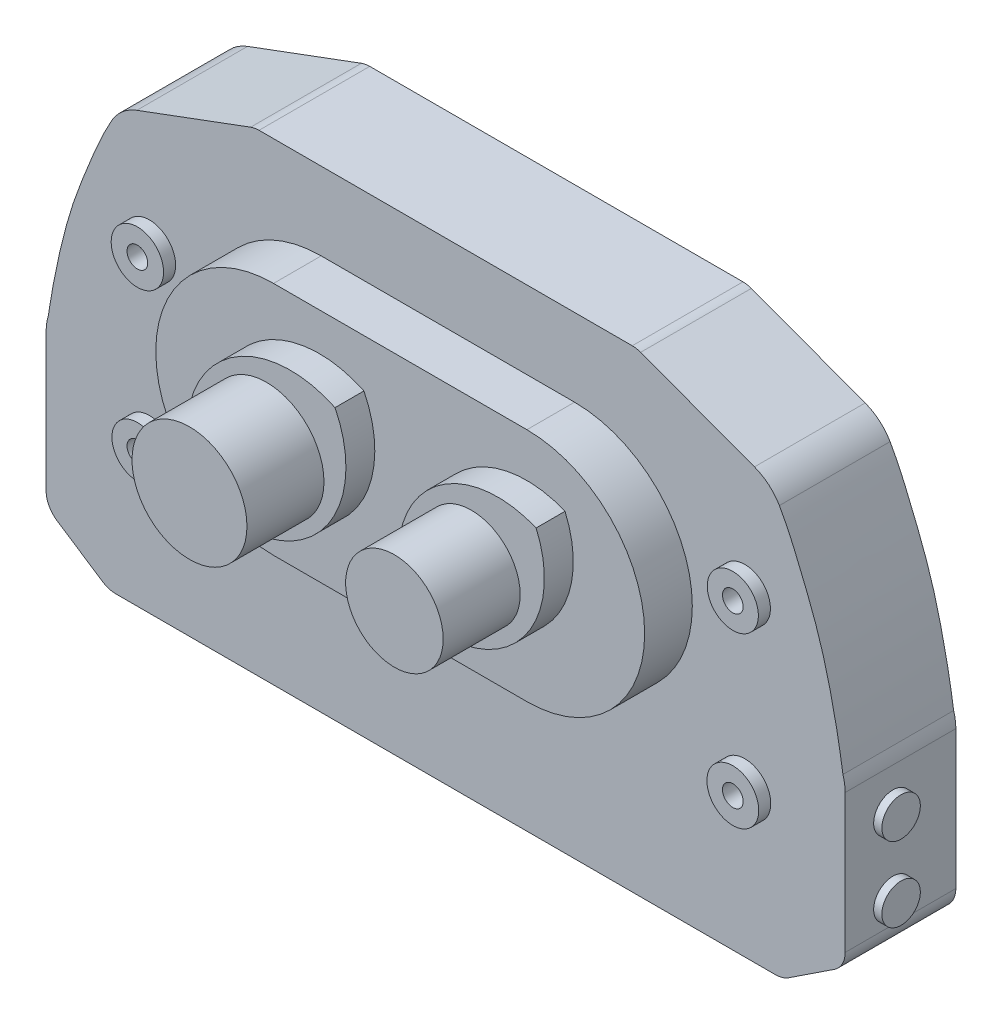
from build123d import *

# Parameters (mm, degrees)
BOSS_EXTRUDE1_DEPTH = 23
SKETCH5_R           = 4
BOSS_EXTRUDE3_DEPTH = 1.7
SKETCH8_R           = 4
BOSS_EXTRUDE4_DEPTH = 1.7
SKETCH12_R          = 5.309585237
SKETCH12_R_2        = 5.383577716
SKETCH12_R_3        = 5.290961271
SKETCH12_R_4        = 5.444301549
BOSS_EXTRUDE5_DEPTH = 9.9
BOSS_EXTRUDE6_DEPTH = 22
CUT_EXTRUDE1_START  = -16
SKETCH16_R          = 11.94
CUT_EXTRUDE1_DEPTH  = 16
CUT_EXTRUDE2_START  = -16
SKETCH17_R          = 10.13
CUT_EXTRUDE2_DEPTH  = 16
CUT_EXTRUDE3_START  = -7.4
SKETCH18_R          = 5.309585237
CUT_EXTRUDE3_DEPTH  = 7.4
CUT_EXTRUDE4_START  = -7.4
SKETCH19_R          = 5.383577716
CUT_EXTRUDE4_DEPTH  = 7.4
CUT_EXTRUDE5_START  = -7.4
SKETCH20_R          = 5.444301549
CUT_EXTRUDE5_DEPTH  = 7.4
CUT_EXTRUDE6_START  = -7.4
SKETCH21_R          = 5.290961271
CUT_EXTRUDE6_DEPTH  = 7.4
SKETCH22_R          = 2.15
CUT_EXTRUDE7_DEPTH  = 10


with BuildPart() as part:
    # Sketch2 → Boss-Extrude1 (new body)
    with BuildSketch(Plane.XY):
        with BuildLine():
            Line((70.523413182, -121.258597495), (80.001788964, -115.008475165))
            ThreePointArc((80.001788964, -115.008475165), (81.651709385, -113.204688447), (82.249297777, -110.834293536))
            Line((82.249297777, -110.834293536), (82.249297777, -82.060728072))
            ThreePointArc((82.249297777, -82.060728072), (82.132627635, -80.537642087), (81.785339594, -79.050095835))
            add(Edge.make_bspline(
                [(81.785339594, -79.050095835), (81.779550585, -79.03175941), (79.763594577, -64.21980724), (72.310783114, -44.632084365), (70.089271073, -39.87053002), (68.584818962, -37.26596578)],
                knots=[0.01010668, 0.01010668, 0.01010668, 0.01010668, 0.430228508, 0.512694162, 0.834763224, 0.834763224, 0.834763224, 0.834763224], degree=3))
            ThreePointArc((68.584818962, -37.26596578), (66.377835563, -34.627803803), (63.407507036, -32.893496223))
            Line((63.407507036, -32.893496223), (39.759590264, -24.109812278))
            ThreePointArc((39.759590264, -24.109812278), (38.90305511, -23.875770322), (38.018627658, -23.796927511))
            Line((38.018627658, -23.796927511), (-39.520032104, -23.796927511))
            ThreePointArc((-39.520032104, -23.796927511), (-40.404459556, -23.875770322), (-41.26099471, -24.109812278))
            Line((-41.26099471, -24.109812278), (-64.908911482, -32.893496223))
            ThreePointArc((-64.908911482, -32.893496223), (-67.879240009, -34.627803803), (-70.086223408, -37.26596578))
            add(Edge.make_bspline(
                [(-83.28674404, -79.050095835), (-83.280955031, -79.03175941), (-81.264999023, -64.21980724), (-73.81218756, -44.632084365), (-71.590675519, -39.87053002), (-70.086223408, -37.26596578)],
                knots=[0.01010668, 0.01010668, 0.01010668, 0.01010668, 0.430228508, 0.512694162, 0.834763224, 0.834763224, 0.834763224, 0.834763224], degree=3))
            ThreePointArc((-83.28674404, -79.050095835), (-83.634032081, -80.537642087), (-83.750702223, -82.060728072))
            Line((-83.750702223, -82.060728072), (-83.750702223, -110.834293536))
            ThreePointArc((-83.750702223, -110.834293536), (-83.153113831, -113.204688447), (-81.50319341, -115.008475165))
            Line((-81.50319341, -115.008475165), (-72.024817629, -121.258597495))
            ThreePointArc((-72.024817629, -121.258597495), (-70.709179228, -121.873513284), (-69.272326442, -122.084415867))
            Line((-69.272326442, -122.084415867), (67.770921996, -122.084415867))
            ThreePointArc((67.770921996, -122.084415867), (69.207774782, -121.873513284), (70.523413182, -121.258597495))
        make_face()
    extrude(amount=BOSS_EXTRUDE1_DEPTH)

    # Sketch5 → Boss-Extrude3 (add)
    with BuildSketch(Plane.ZY.offset(83.750702223)):
        with Locations((13.083649818, -90.551709518)):
            Circle(SKETCH5_R)
        with Locations((13.083649818, -106.069633318)):
            Circle(SKETCH5_R)
    extrude(amount=BOSS_EXTRUDE3_DEPTH)

    # Sketch8 → Boss-Extrude4 (add)
    with BuildSketch(Plane(origin=(82.249297777, 0, 0), x_dir=(0, 0, -1), z_dir=(1, 0, 0))):
        with Locations((-13.08, -90.550728072)):
            Circle(SKETCH8_R)
        with Locations((-13.08, -106.070728072)):
            Circle(SKETCH8_R)
    extrude(amount=BOSS_EXTRUDE4_DEPTH)

    # Sketch12 → Boss-Extrude5 (add)
    with BuildSketch(Plane.XY.offset(23)):
        with Locations((61.412858859, -56.74856372)):
            Circle(SKETCH12_R)
        with Locations((61.412858859, -91.784557501)):
            Circle(SKETCH12_R_2)
        with Locations((-62.293922582, -91.784557501)):
            Circle(SKETCH12_R_3)
        with Locations((-62.293922582, -56.74856372)):
            Circle(SKETCH12_R_4)
        with BuildLine():
            Line((26.03317791, -39.941081705), (-26.605656617, -39.941081705))
            ThreePointArc((-26.605656617, -39.941081705), (-51.069934746, -64.405359834), (-26.605656617, -88.869637962))
            Line((-26.605656617, -88.869637962), (26.03317791, -88.869637962))
            ThreePointArc((26.03317791, -88.869637962), (50.497456038, -64.405359834), (26.03317791, -39.941081705))
        make_face()
    extrude(amount=BOSS_EXTRUDE5_DEPTH)

    # Sketch15 → Boss-Extrude6 (add)
    with BuildSketch(Plane.XY.offset(32.9)):
        with BuildLine():
            ThreePointArc((-36.30694092, -78.897586955), (-32.416918561, -54.237740907), (-7.831564022, -49.901772358))
            ThreePointArc((-7.831564022, -49.901772358), (-11.721586381, -74.561618406), (-36.30694092, -78.897586955))
        make_face()
        with BuildLine():
            ThreePointArc((33.947027157, -50.665986501), (29.727203797, -73.404384895), (7.056950152, -77.976175614))
            ThreePointArc((7.056950152, -77.976175614), (11.276773512, -55.23777722), (33.947027157, -50.665986501))
        make_face()
    extrude(amount=BOSS_EXTRUDE6_DEPTH)

    # Sketch16 → Cut-Extrude1 (cut)
    with BuildSketch(Plane.XY.offset(54.9).offset(CUT_EXTRUDE1_START)):
        with BuildLine():
            ThreePointArc((-36.30694092, -78.897586955), (-32.416918561, -54.237740907), (-7.831564022, -49.901772358))
            ThreePointArc((-7.831564022, -49.901772358), (-11.721586381, -74.561618406), (-36.30694092, -78.897586955))
        make_face()
        with Locations((-22.069252471, -64.399679657)):
            Circle(SKETCH16_R, mode=Mode.SUBTRACT)
    extrude(amount=CUT_EXTRUDE1_DEPTH, mode=Mode.SUBTRACT)

    # Sketch17 → Cut-Extrude2 (cut)
    with BuildSketch(Plane.XY.offset(54.9).offset(CUT_EXTRUDE2_START)):
        with BuildLine():
            ThreePointArc((7.056950152, -77.976175614), (11.276773512, -55.23777722), (33.947027157, -50.665986501))
            ThreePointArc((33.947027157, -50.665986501), (29.727203797, -73.404384895), (7.056950152, -77.976175614))
        make_face()
        with Locations((20.501988655, -64.321081058)):
            Circle(SKETCH17_R, mode=Mode.SUBTRACT)
    extrude(amount=CUT_EXTRUDE2_DEPTH, mode=Mode.SUBTRACT)

    # Sketch18 → Cut-Extrude3 (cut)
    with BuildSketch(Plane.XY.offset(32.9).offset(CUT_EXTRUDE3_START)):
        with Locations((61.412858859, -56.74856372)):
            Circle(SKETCH18_R)
    extrude(amount=CUT_EXTRUDE3_DEPTH, mode=Mode.SUBTRACT)

    # Sketch19 → Cut-Extrude4 (cut)
    with BuildSketch(Plane.XY.offset(32.9).offset(CUT_EXTRUDE4_START)):
        with Locations((61.412858859, -91.784557501)):
            Circle(SKETCH19_R)
    extrude(amount=CUT_EXTRUDE4_DEPTH, mode=Mode.SUBTRACT)

    # Sketch20 → Cut-Extrude5 (cut)
    with BuildSketch(Plane.XY.offset(32.9).offset(CUT_EXTRUDE5_START)):
        with Locations((-62.293922582, -56.74856372)):
            Circle(SKETCH20_R)
    extrude(amount=CUT_EXTRUDE5_DEPTH, mode=Mode.SUBTRACT)

    # Sketch21 → Cut-Extrude6 (cut)
    with BuildSketch(Plane.XY.offset(32.9).offset(CUT_EXTRUDE6_START)):
        with Locations((-62.293922582, -91.784557501)):
            Circle(SKETCH21_R)
    extrude(amount=CUT_EXTRUDE6_DEPTH, mode=Mode.SUBTRACT)

    # Sketch22 → Cut-Extrude7 (cut)
    with BuildSketch(Plane.XY.offset(25.5)):
        with Locations((-62.293922582, -56.74856372)):
            Circle(SKETCH22_R)
        with Locations((-62.293922582, -91.784557501)):
            Circle(SKETCH22_R)
        with Locations((61.412858859, -91.784557501)):
            Circle(SKETCH22_R)
        with Locations((61.412858859, -56.74856372)):
            Circle(SKETCH22_R)
    extrude(amount=-CUT_EXTRUDE7_DEPTH, mode=Mode.SUBTRACT)


solid = part.part
